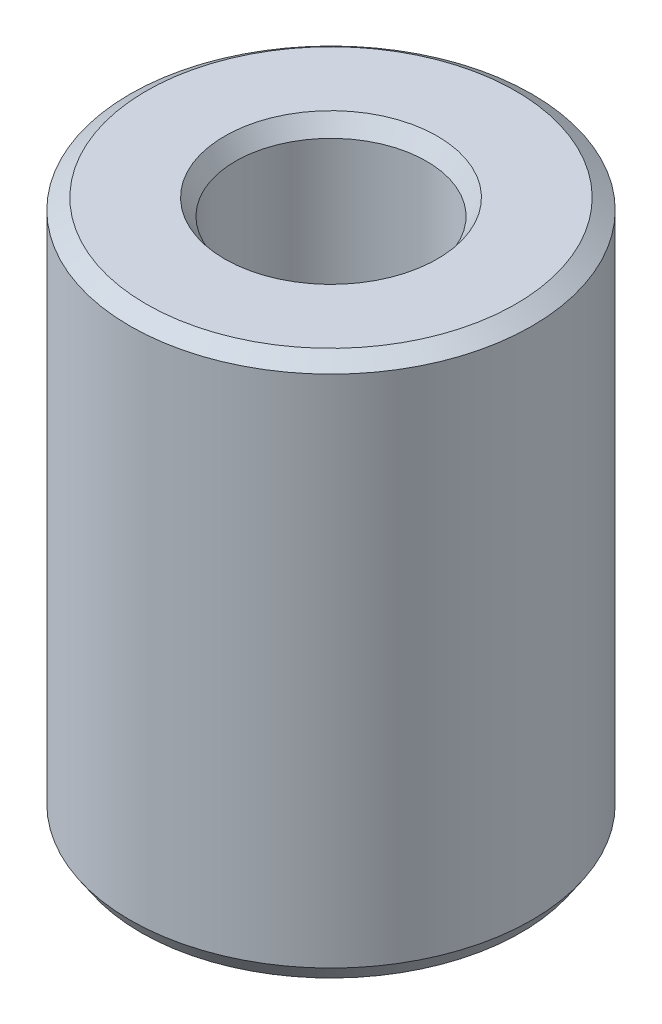
from build123d import *
from OCP.BRepFilletAPI import BRepFilletAPI_MakeChamfer

# Parameters (mm, degrees)
SKETCH1_R           = 10
BOSS_EXTRUDE1_DEPTH = 26.945556801
SKETCH2_R           = 4.754256719
CUT_EXTRUDE1_DEPTH  = 31.431283761
CHAMFER1_SIZE       = 0.54074029
CHAMFER1_SIZE2      = 0.809757185


with BuildPart() as part:
    # Sketch1 → Boss-Extrude1 (new body)
    with BuildSketch(Plane(origin=(0, 0, 0), x_dir=(1, 0, 0), z_dir=(0, 1, 0))):
        Circle(SKETCH1_R)
    extrude(amount=BOSS_EXTRUDE1_DEPTH)

    # Sketch2 → Cut-Extrude1 (cut, through all)
    with BuildSketch(Plane(origin=(0, 0, 0), x_dir=(1, 0, 0), z_dir=(0, 1, 0))):
        Circle(SKETCH2_R)
    extrude(amount=CUT_EXTRUDE1_DEPTH, mode=Mode.SUBTRACT)

    # Chamfer1: one chamfer whose edges measure the first distance from different faces: ONE call of the kernel's chamfer builder (chamfer() names one face for all edges)
    chamfer1_edges_1 = [part.edges().sort_by_distance(p)[0] for p in [
        (-4.754256719, 26.945556801, 0),
    ]]
    chamfer1_side_1 = [part.faces().sort_by_distance(p)[0] for p in [
        (-9.717157288, 26.945556801, 0),
    ]]
    chamfer1_edges_2 = [part.edges().sort_by_distance(p)[0] for p in [
        (-4.754256719, 0, 0),
    ]]
    chamfer1_side_2 = [part.faces().sort_by_distance(p)[0] for p in [
        (-4.754256719, 13.472778401, 0),
    ]]
    chamfer1_edges_3 = [part.edges().sort_by_distance(p)[0] for p in [
        (-10, 0, 0),
    ]]
    chamfer1_side_3 = [part.faces().sort_by_distance(p)[0] for p in [
        (-9.717157288, 0, 0),
    ]]
    chamfer1_edges_4 = [part.edges().sort_by_distance(p)[0] for p in [
        (-10, 26.945556801, 0),
    ]]
    chamfer1_side_4 = [part.faces().sort_by_distance(p)[0] for p in [
        (-10, 13.472778401, 0),
    ]]
    chamfer1 = BRepFilletAPI_MakeChamfer(part.part.solid().wrapped)
    for e in chamfer1_edges_1:
        chamfer1.Add(CHAMFER1_SIZE, CHAMFER1_SIZE2, e.wrapped, chamfer1_side_1[0].wrapped)  # the first distance lies on this face
    for e in chamfer1_edges_2:
        chamfer1.Add(CHAMFER1_SIZE, CHAMFER1_SIZE2, e.wrapped, chamfer1_side_2[0].wrapped)  # the first distance lies on this face
    for e in chamfer1_edges_3:
        chamfer1.Add(CHAMFER1_SIZE, CHAMFER1_SIZE2, e.wrapped, chamfer1_side_3[0].wrapped)  # the first distance lies on this face
    for e in chamfer1_edges_4:
        chamfer1.Add(CHAMFER1_SIZE, CHAMFER1_SIZE2, e.wrapped, chamfer1_side_4[0].wrapped)  # the first distance lies on this face
    add(Compound.cast(chamfer1.Shape()), mode=Mode.REPLACE)


solid = part.part
